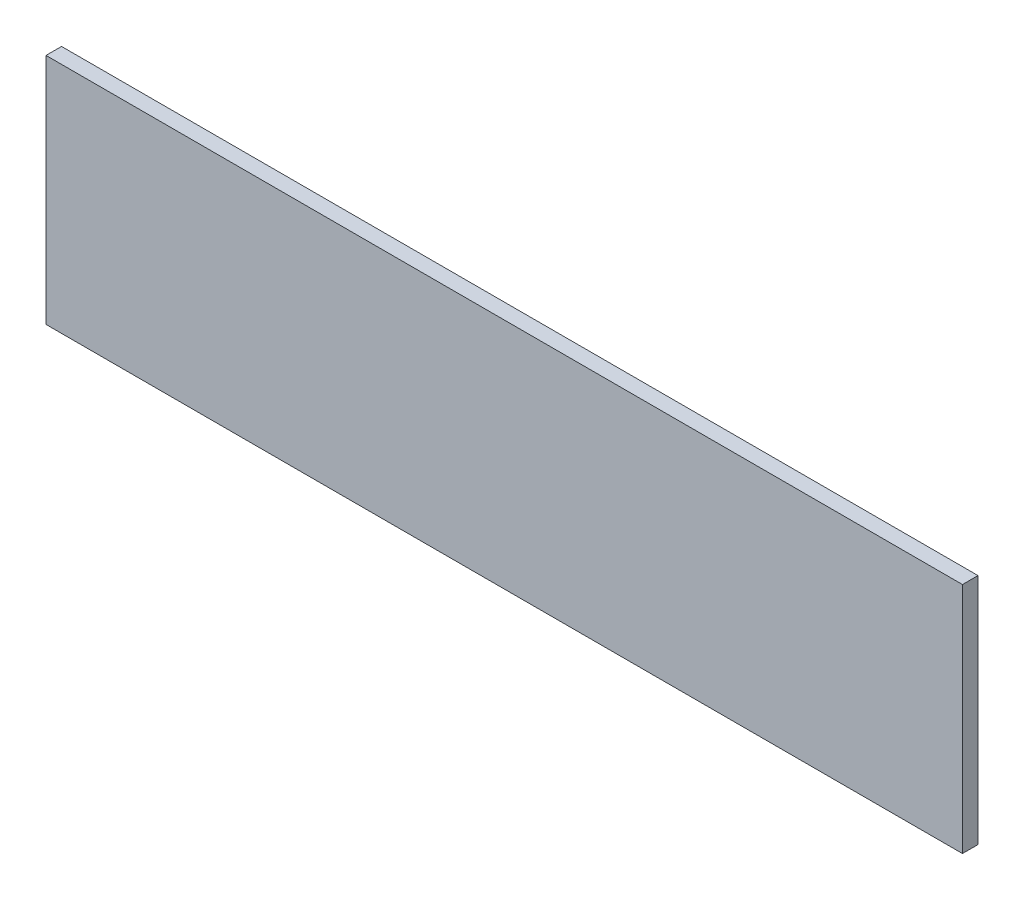
from build123d import *

# Parameters (mm, degrees)
SKIZZE1_W                       = 590
SKIZZE1_H                       = 150
AUFSATZ_LINEAR_AUSTRAGEN1_DEPTH = 10


with BuildPart() as part:
    # Skizze1 → Aufsatz-Linear austragen1 (new body)
    with BuildSketch(Plane.XY):
        Rectangle(SKIZZE1_W, SKIZZE1_H)
    extrude(amount=AUFSATZ_LINEAR_AUSTRAGEN1_DEPTH)


solid = part.part
